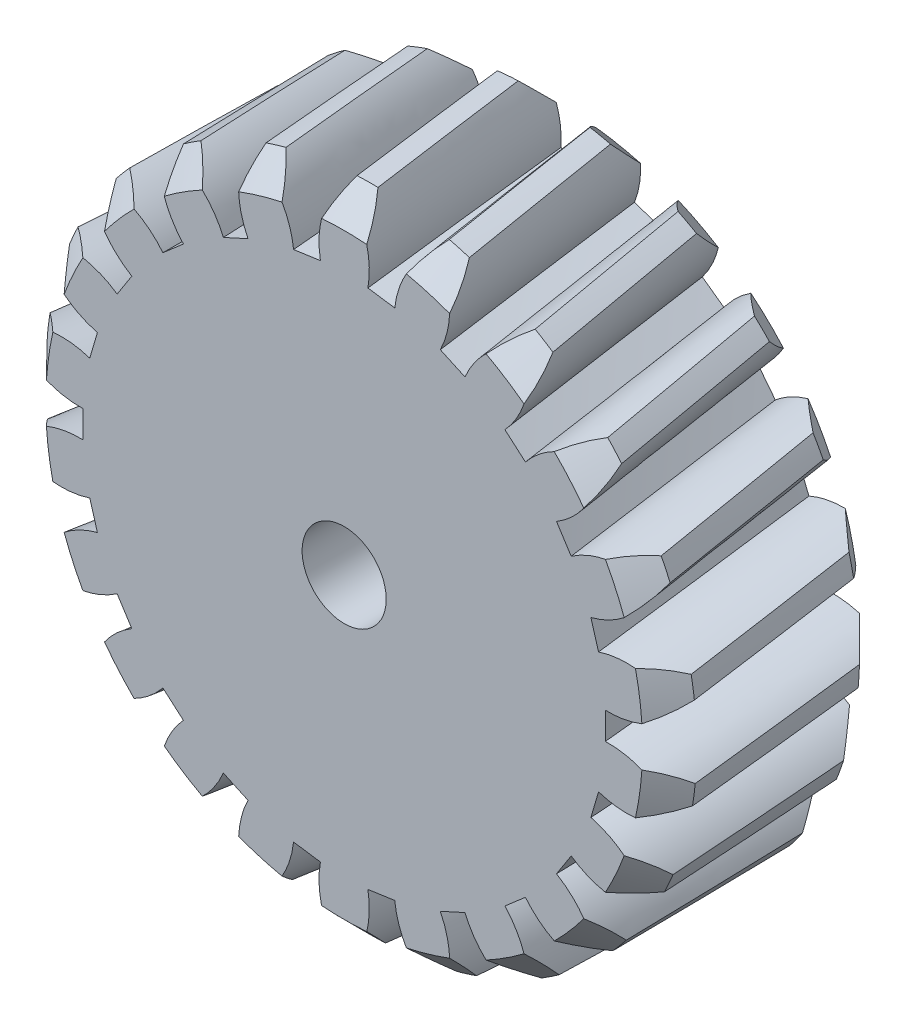
from build123d import *

# Parameters (mm, degrees)
SKETCH5_R           = 12
BOSS_EXTRUDE1_DEPTH = 8
CHAMFER1_SIZE       = 1
CUT_SWEEP1_PITCH    = 544.959128065
CIRPATTERN1_COUNT   = 22
SKETCH11_R          = 2.95
CUT_EXTRUDE1_DEPTH  = 2.75
SKETCH12_R          = 1.55
CUT_EXTRUDE2_DEPTH  = 10


with BuildPart() as part:
    # Sketch5 → Boss-Extrude1 (new body)
    with BuildSketch(Plane(origin=(0, 0, 0), x_dir=(0, 1, 0), z_dir=(0, 0, 1))):
        with Locations(Location((0, 0, 0), (0, 0, 270))):
            Circle(SKETCH5_R)
    extrude(amount=BOSS_EXTRUDE1_DEPTH)

    # Chamfer1
    chamfer1_edges = [part.edges().sort_by_distance(p)[0] for p in [
        (-12, 0, 0),
        (-12, 0, 8),
    ]]
    chamfer(chamfer1_edges, length=CHAMFER1_SIZE)

    # Cut-Sweep1: the profile of Sketch10 screwed along a left-hand helix of 0.0367 turns, 60 arcs to a turn; built about Z, then put on its axis
    cut_sweep1_z = Axis((0, 0, 0), (0, 0, 1))
    cut_sweep1_corners = [(-9.626624627, 0.5, 0), (-9.626624627, -0.5, 0), (-11.926624627, -1.325, 0), (-11.926624627, 1.325, 0)]
    with BuildLine(mode=Mode.PRIVATE) as cut_sweep1_profile:
        Line(cut_sweep1_corners[0], cut_sweep1_corners[1])
        ThreePointArc((-9.626624627, -0.5, 0), (-10.855796467, -0.691778507, 0), (-11.926624627, -1.325, 0))
        ThreePointArc((-11.926624627, -1.325, 0), (-12, 0, 0), (-11.926624627, 1.325, 0))
        ThreePointArc((-11.926624627, 1.325, 0), (-10.855796467, 0.691778507, 0), (-9.626624627, 0.5, 0))
    cut_sweep1_cap = Face(cut_sweep1_profile.wire())
    cut_sweep1_arcs = [((-9.626624627, -0.5, 0), (-10.941024432, -0.454173271, 0), (-11.926624627, -1.325, 0), (1, 0.9289420382222412, 1)), ((-11.926624627, -1.325, 0), (-12.073826795, 0, 0), (-11.926624627, 1.325, 0), (1, 0.9938853856065206, 1)), ((-11.926624627, 1.325, 0), (-10.941024432, 0.454173271, 0), (-9.626624627, 0.5, 0), (1, 0.9289420382222414, 1))]  # start, shoulder, end, weights
    cut_sweep1_turn_angles = [0, -3, -6, -9, -12, -12.606, -13.212]
    cut_sweep1_turn_weights = [1, 0.9986295347545738, 1, 0.9986295347545738, 1, 0.9999440672800329, 1]
    cut_sweep1_turn_rails = [Edge.make_bspline([Vector(p[0], p[1], 0).rotate(cut_sweep1_z, cut_sweep1_turn_angles[k]) / cut_sweep1_turn_weights[k] + Vector(0, 0, p[2] + -CUT_SWEEP1_PITCH * cut_sweep1_turn_angles[k] / 360) for k in range(7)], [0, 0, 0, 1, 1, 2, 2, 3, 3, 3], 2, cut_sweep1_turn_weights) for p in cut_sweep1_corners]
    cut_sweep1_turn_sides = [*[Face.make_surface_from_curves(cut_sweep1_turn_rails[p[0]], cut_sweep1_turn_rails[p[1]]) for p in [(0, 1)]], *[Face.make_bezier_surface([[Vector(p[j][0], p[j][1], 0).rotate(cut_sweep1_z, cut_sweep1_turn_angles[2 * i + k]) / cut_sweep1_turn_weights[2 * i + k] + Vector(0, 0, p[j][2] + -CUT_SWEEP1_PITCH * cut_sweep1_turn_angles[2 * i + k] / 360) for k in range(3)] for j in range(3)], [[p[3][j] * cut_sweep1_turn_weights[2 * i + k] for k in range(3)] for j in range(3)]) for p in cut_sweep1_arcs for i in range(3)]]
    cut_sweep1 = Plane(origin=(0, 0, 8), x_dir=(-1, 0, 0), z_dir=(0, 0, -1)) * Solid(Shell([*cut_sweep1_turn_sides, cut_sweep1_cap, cut_sweep1_cap.rotate(cut_sweep1_z, -13.212).moved(Location((0, 0, -CUT_SWEEP1_PITCH * -13.212 / 360)))]))
    add(cut_sweep1, mode=Mode.SUBTRACT)

    # CirPattern1: Cut-Sweep1 ×22 about axis
    cirpattern1_axis = Axis((0, 0, 8), (0, 0, -1))
    for i in range(1, CIRPATTERN1_COUNT):
        add(cut_sweep1.rotate(cirpattern1_axis, i * 360 / CIRPATTERN1_COUNT), mode=Mode.SUBTRACT)

    # Sketch11 → Cut-Extrude1 (cut)
    with BuildSketch(Plane(origin=(0, 0, 0), x_dir=(0, 1, 0), z_dir=(0, 0, 1))):
        with Locations(Location((0, 0, 0), (0, 0, 270))):
            Circle(SKETCH11_R)
    extrude(amount=CUT_EXTRUDE1_DEPTH, mode=Mode.SUBTRACT)

    # Sketch12 → Cut-Extrude2 (cut)
    with BuildSketch(Plane(origin=(0, 0, 0), x_dir=(0, 1, 0), z_dir=(0, 0, 1))):
        with Locations(Location((0, 0, 0), (0, 0, 270))):
            Circle(SKETCH12_R)
    extrude(amount=CUT_EXTRUDE2_DEPTH, mode=Mode.SUBTRACT)


solid = part.part
